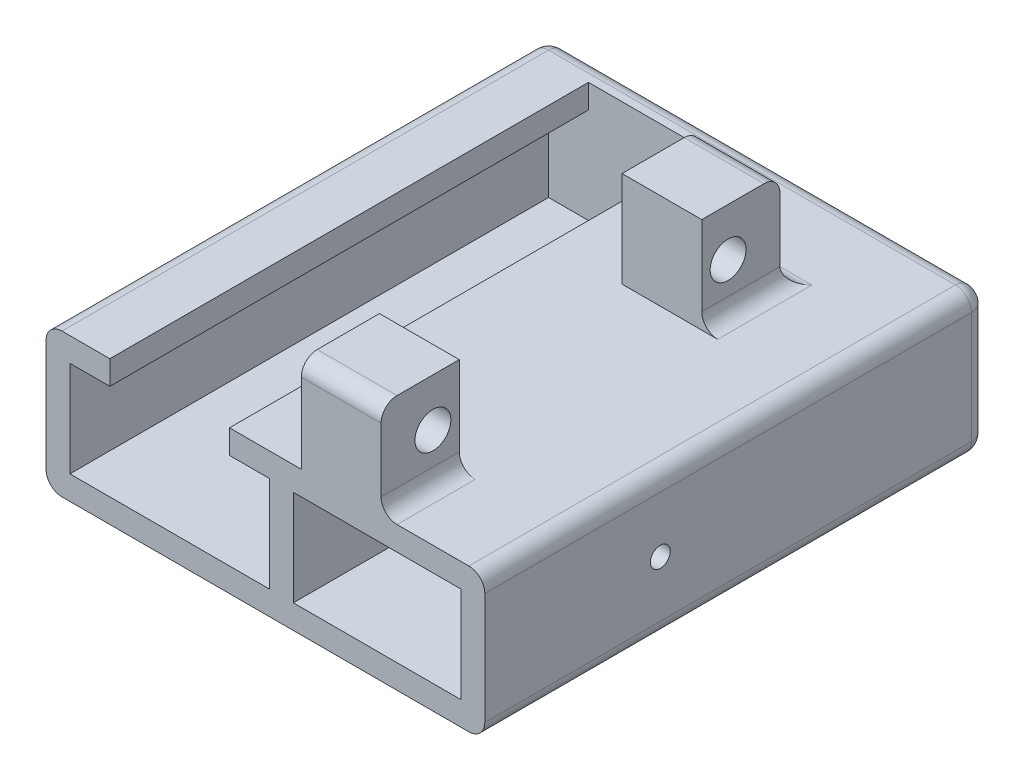
from build123d import *

# Parameters (mm, degrees)
SKETCH1_W           = 21
SKETCH1_H           = 12
BOSS_EXTRUDE1_DEPTH = 60
SKETCH2_R           = 2.25
BOSS_EXTRUDE2_DEPTH = 10
SKETCH3_W           = 55
SKETCH3_H           = 18
BOSS_EXTRUDE3_DEPTH = 3
FILLET1_R           = 2
SKETCH4_R           = 1.25
CUT_EXTRUDE1_DEPTH  = 30


with BuildPart() as part:
    # Sketch1 → Boss-Extrude1 (new body)
    with BuildSketch(Plane.XY):
        Polygon((17.509291985, 21.588576814), (-9.490708015, 21.588576814), (-14.490708015, 21.588576814), (-14.490708015, 18.588576814), (-9.490708015, 18.588576814), (-9.490708015, 6.588576814), (-34.490708015, 6.588576814), (-34.490708015, 18.588576814), (-29.490708015, 18.588576814), (-29.490708015, 21.588576814), (-34.490708015, 21.588576814), (-37.490708015, 21.588576814), (-37.490708015, 3.588576814), (17.509291985, 3.588576814), align=None)
        with Locations((4.009291985, 12.588576814)):
            Rectangle(SKETCH1_W, SKETCH1_H, mode=Mode.SUBTRACT)
    extrude(amount=-BOSS_EXTRUDE1_DEPTH)

    # Sketch2 → Boss-Extrude2 (add)
    # profile 1 of 2: a face of its own
    with BuildSketch(Plane(origin=(-5.490708015, 0, 0), x_dir=(0, 0, -1), z_dir=(1, 0, 0))):
        with BuildLine():
            Line((50, 21.588576814), (40.2, 21.588576814))
            Line((40.2, 21.588576814), (40.2, 33.588576814))
            Line((40.2, 33.588576814), (48, 33.588576814))
            ThreePointArc((48, 33.588576814), (49.414213562, 33.002790376), (50, 31.588576814))
            Line((50, 31.588576814), (50, 21.588576814))
        make_face()
        with Locations((43.5, 27.588576814)):
            Circle(SKETCH2_R, mode=Mode.SUBTRACT)
    # profile 2 of 2: a face of its own
    with BuildSketch(Plane(origin=(-5.490708015, 0, 0), x_dir=(0, 0, -1), z_dir=(1, 0, 0))):
        with BuildLine():
            Line((9.8, 21.588576814), (0, 21.588576814))
            Line((0, 21.588576814), (0, 31.588576814))
            ThreePointArc((0, 31.588576814), (0.585786438, 33.002790376), (2, 33.588576814))
            Line((2, 33.588576814), (9.8, 33.588576814))
            Line((9.8, 33.588576814), (9.8, 21.588576814))
        make_face()
        with Locations((6.5, 27.588576814)):
            Circle(SKETCH2_R, mode=Mode.SUBTRACT)
    extrude(amount=BOSS_EXTRUDE2_DEPTH)

    # Sketch3 → Boss-Extrude3 (add)
    with BuildSketch(Plane(origin=(0, 0, -60), x_dir=(-1, 0, 0), z_dir=(0, 0, -1))):
        with Locations((9.990708015, 12.588576814)):
            Rectangle(SKETCH3_W, SKETCH3_H)
    extrude(amount=BOSS_EXTRUDE3_DEPTH)

    # Fillet1
    fillet1_edges = [part.edges().sort_by_distance(p)[0] for p in [
        (17.509291985, 21.588576814, -31.5),
        (17.509291985, 3.588576814, -31.5),
        (-37.490708015, 3.588576814, -31.5),
        (-37.490708015, 21.588576814, -31.5),
        (-9.990708015, 21.588576814, -63),
        (-37.490708015, 12.588576814, -63),
        (-9.990708015, 3.588576814, -63),
        (17.509291985, 12.588576814, -63),
        (4.509291985, 21.588576814, -4.9),
        (-0.490708015, 21.588576814, -50),
        (4.509291985, 21.588576814, -45.1),
    ]]
    fillet(fillet1_edges, radius=FILLET1_R)

    # Sketch4 → Cut-Extrude1 (cut)
    with BuildSketch(Plane(origin=(17.509291985, 0, 0), x_dir=(0, 0, -1), z_dir=(1, 0, 0))):
        with Locations((22, 12.588576814)):
            Circle(SKETCH4_R)
    extrude(amount=-CUT_EXTRUDE1_DEPTH, mode=Mode.SUBTRACT)


solid = part.part
